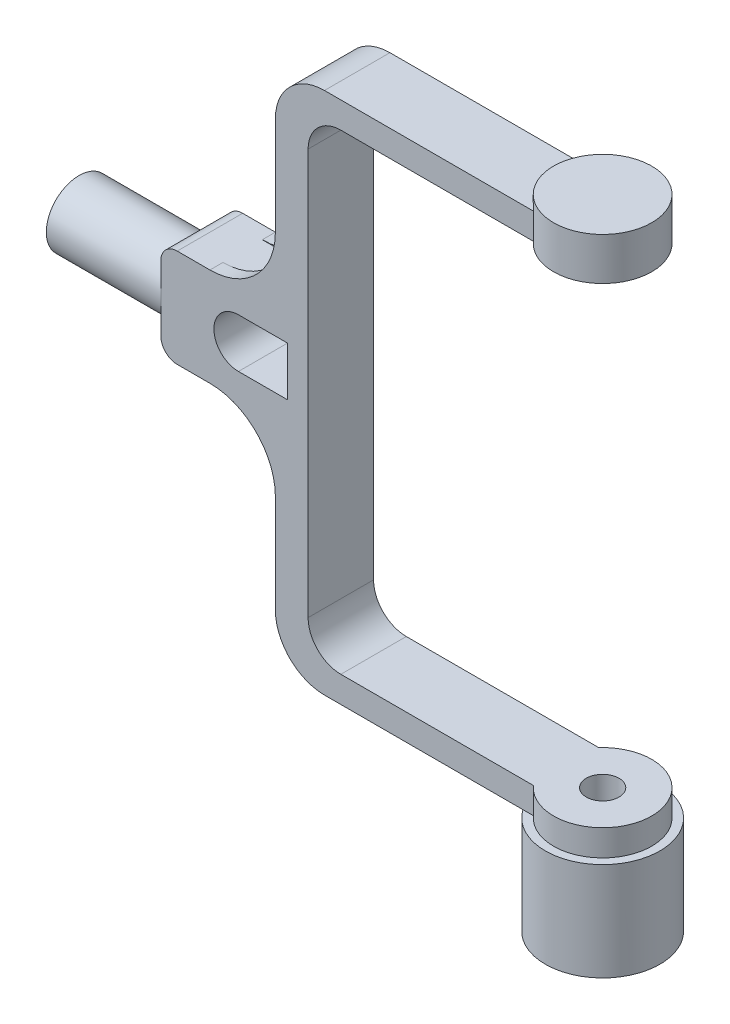
from build123d import *

# Parameters (mm, degrees)
SKETCH1_R                = 10
BOSS_EXTRUDE1_DEPTH      = 35
SKETCH2_W                = 20
SKETCH2_H                = 30
BOSS_EXTRUDE2_DEPTH      = 35
BOSS_EXTRUDE3_DEPTH      = 80
BOSS_EXTRUDE3_DEPTH_BACK = 80
SKETCH3_W                = 20
SKETCH3_H                = 10
SKETCH4_W                = 20
SKETCH4_H                = 8
BOSS_EXTRUDE4_DEPTH      = 65
SKETCH5_R                = 5
BOSS_EXTRUDE6_DEPTH      = 8
BOSS_EXTRUDE7_START      = -8
SKETCH6_R                = 5
BOSS_EXTRUDE7_DEPTH      = 8
FILLET1_R                = 15
FILLET2_R                = 10
FILLET3_R                = 10
FILLET4_R                = 15
FILLET5_R                = 20
FILLET6_R                = 20
SKETCH7_W                = 12
SKETCH7_H                = 20
CUT_EXTRUDE1_DEPTH       = 30
SKETCH8_R                = 17.5
BOSS_EXTRUDE8_DEPTH      = 30
SKETCH9_R                = 5
CUT_EXTRUDE2_DEPTH       = 20
BOSS_EXTRUDE9_START      = 5
SKETCH10_R               = 15
BOSS_EXTRUDE9_DEPTH      = 5
CUT_EXTRUDE4_START       = -2
SKETCH11_R               = 5
CUT_EXTRUDE4_DEPTH       = 2
CUT_EXTRUDE5_DEPTH       = 211.624072698
FILLET9_R                = 5
BODY_MOVE_COPY1_ANGLE    = 90


with BuildPart() as part:
    # Sketch1 → Boss-Extrude1 (new body)
    with BuildSketch(Plane.XY):
        Circle(SKETCH1_R)
    extrude(amount=BOSS_EXTRUDE1_DEPTH)

    # Sketch2 → Boss-Extrude2 (add)
    with BuildSketch(Plane.XY.offset(35)):
        Rectangle(SKETCH2_W, SKETCH2_H)
    extrude(amount=BOSS_EXTRUDE2_DEPTH)

    # Sketch3 → Boss-Extrude3 (add, two sides: drawn at the far end of the back side and taken through both)
    with BuildSketch(Plane(origin=(0, 0, 0), x_dir=(1, 0, 0), z_dir=(0, 1, 0)).offset(-BOSS_EXTRUDE3_DEPTH_BACK)):
        with Locations((0, -75)):
            Rectangle(SKETCH3_W, SKETCH3_H)
    extrude(amount=BOSS_EXTRUDE3_DEPTH + BOSS_EXTRUDE3_DEPTH_BACK)

    # Sketch4 → Boss-Extrude4 (add)
    with BuildSketch(Plane.XY.offset(80)):
        with Locations((0, 76)):
            Rectangle(SKETCH4_W, SKETCH4_H)
        with Locations((0, -76)):
            Rectangle(SKETCH4_W, SKETCH4_H)
    extrude(amount=BOSS_EXTRUDE4_DEPTH)

    # Sketch5 → Boss-Extrude6 (add)
    with BuildSketch(Plane(origin=(0, 80, 0), x_dir=(1, 0, 0), z_dir=(0, 1, 0))):
        with BuildLine():
            Line((10, -145), (10, -148.819660113))
            ThreePointArc((10, -148.819660113), (0, -175), (-10, -148.819660113))
            Line((-10, -148.819660113), (-10, -145))
            Line((-10, -145), (10, -145))
        make_face()
        with Locations(Location((0, -160, 0), (0, 0, 270))):
            Circle(SKETCH5_R, mode=Mode.SUBTRACT)
    extrude(amount=-BOSS_EXTRUDE6_DEPTH)

    # Sketch6 → Boss-Extrude7 (add)
    with BuildSketch(Plane.XZ.offset(80).offset(BOSS_EXTRUDE7_START)):
        with BuildLine():
            Line((-10, 148.819660113), (-10, 145))
            Line((-10, 145), (10, 145))
            Line((10, 145), (10, 148.819660113))
            ThreePointArc((10, 148.819660113), (0, 175), (-10, 148.819660113))
        make_face()
        with Locations(Location((0, 160, 0), (0, 0, 90))):
            Circle(SKETCH6_R, mode=Mode.SUBTRACT)
    extrude(amount=BOSS_EXTRUDE7_DEPTH)

    # Fillet1
    fillet1_edges = [part.edges().sort_by_distance(p)[0] for p in [
        (0, 80, 70),
    ]]
    fillet(fillet1_edges, radius=FILLET1_R)

    # Fillet2
    fillet2_edges = [part.edges().sort_by_distance(p)[0] for p in [
        (0, 72, 80),
    ]]
    fillet(fillet2_edges, radius=FILLET2_R)

    # Fillet3
    fillet3_edges = [part.edges().sort_by_distance(p)[0] for p in [
        (0, -72, 80),
    ]]
    fillet(fillet3_edges, radius=FILLET3_R)

    # Fillet4
    fillet4_edges = [part.edges().sort_by_distance(p)[0] for p in [
        (0, -80, 70),
    ]]
    fillet(fillet4_edges, radius=FILLET4_R)

    # Fillet5
    fillet5_edges = [part.edges().sort_by_distance(p)[0] for p in [
        (0, 15, 70),
    ]]
    fillet(fillet5_edges, radius=FILLET5_R)

    # Fillet6
    fillet6_edges = [part.edges().sort_by_distance(p)[0] for p in [
        (0, -15, 70),
    ]]
    fillet(fillet6_edges, radius=FILLET6_R)

    # Sketch7 → Cut-Extrude1 (cut)
    with BuildSketch(Plane(origin=(0, 15, 0), x_dir=(1, 0, 0), z_dir=(0, 1, 0))):
        with Locations((0, -60)):
            Rectangle(SKETCH7_W, SKETCH7_H)
    cut_extrude1 = extrude(amount=CUT_EXTRUDE1_DEPTH, mode=Mode.SUBTRACT)

    # Mirror1: Cut-Extrude1 across plane
    add(cut_extrude1.mirror(Plane.ZX), mode=Mode.SUBTRACT)

    # Sketch8 → Boss-Extrude8 (add)
    with BuildSketch(Plane.XZ.offset(80)):
        with Locations(Location((0, 160, 0), (0, 0, 235.150095421))):
            Circle(SKETCH8_R)
    extrude(amount=BOSS_EXTRUDE8_DEPTH)

    # Sketch9 → Cut-Extrude2 (cut)
    with BuildSketch(Plane(origin=(0, -80, 0), x_dir=(1, 0, 0), z_dir=(0, 1, 0))):
        with Locations(Location((0, -160, 0), (0, 0, 270))):
            Circle(SKETCH9_R)
    extrude(amount=-CUT_EXTRUDE2_DEPTH, mode=Mode.SUBTRACT)

    # Sketch10 → Boss-Extrude9 (add)
    with BuildSketch(Plane(origin=(0, 80, 0), x_dir=(1, 0, 0), z_dir=(0, 1, 0)).offset(BOSS_EXTRUDE9_START)):
        with Locations(Location((0, -160, 0), (0, 0, 270))):
            Circle(SKETCH10_R)
    extrude(amount=-BOSS_EXTRUDE9_DEPTH)

    # Sketch11 → Cut-Extrude4 (cut)
    with BuildSketch(Plane.XZ.offset(-80).offset(CUT_EXTRUDE4_START)):
        with Locations(Location((0, 160, 0), (0, 0, 90))):
            Circle(SKETCH11_R)
    extrude(amount=CUT_EXTRUDE4_DEPTH, mode=Mode.SUBTRACT)

    # Sketch12 → Cut-Extrude5 (cut, through all)
    with BuildSketch(Plane(origin=(10, 0, 0), x_dir=(0, 0, -1), z_dir=(1, 0, 0))):
        with BuildLine():
            Line((-73.708886101, 7.5), (-58.708886101, 7.5))
            ThreePointArc((-58.708886101, 7.5), (-51.208886101, 0), (-58.708886101, -7.5))
            Line((-58.708886101, -7.5), (-73.708886101, -7.5))
            Line((-73.708886101, -7.5), (-73.708886101, 7.5))
        make_face()
    extrude(amount=-CUT_EXTRUDE5_DEPTH, mode=Mode.SUBTRACT)

    # Fillet9
    fillet9_edges = [part.edges().sort_by_distance(p)[0] for p in [
        (0, 15, 35),
        (0, -15, 35),
    ]]
    fillet(fillet9_edges, radius=FILLET9_R - 0.0001)  # a hair under: the kernel refuses the full size


with BuildPart() as part_1:
    # Body-Move/Copy1: read off the stored shape, not the designer's step
    # Body-Move/Copy1: moved
    add(part.part.moved(Location((0, 72, -160))).rotate(Axis((0, 0, 0), (0, 1, 0)), BODY_MOVE_COPY1_ANGLE))


solid = part_1.part
